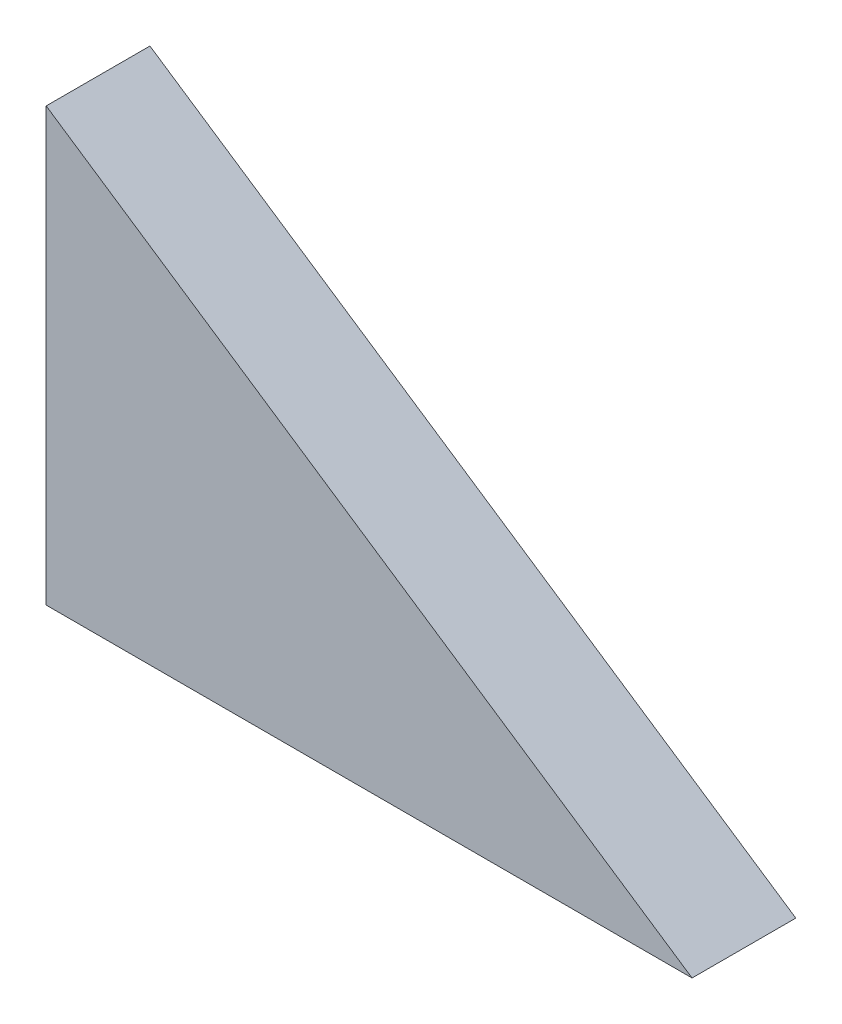
from build123d import *

# Parameters (mm, degrees)
EXTRUDE_1_DEPTH = 6


with BuildPart() as part:
    # Эскиз1 → Бобышка-Вытянуть1 (new body)
    with BuildSketch(Plane.XY):
        Polygon((6, 6.078379342), (6, 31.078379342), (43.35, 6.078379342), align=None)
    extrude(amount=-EXTRUDE_1_DEPTH)


solid = part.part
